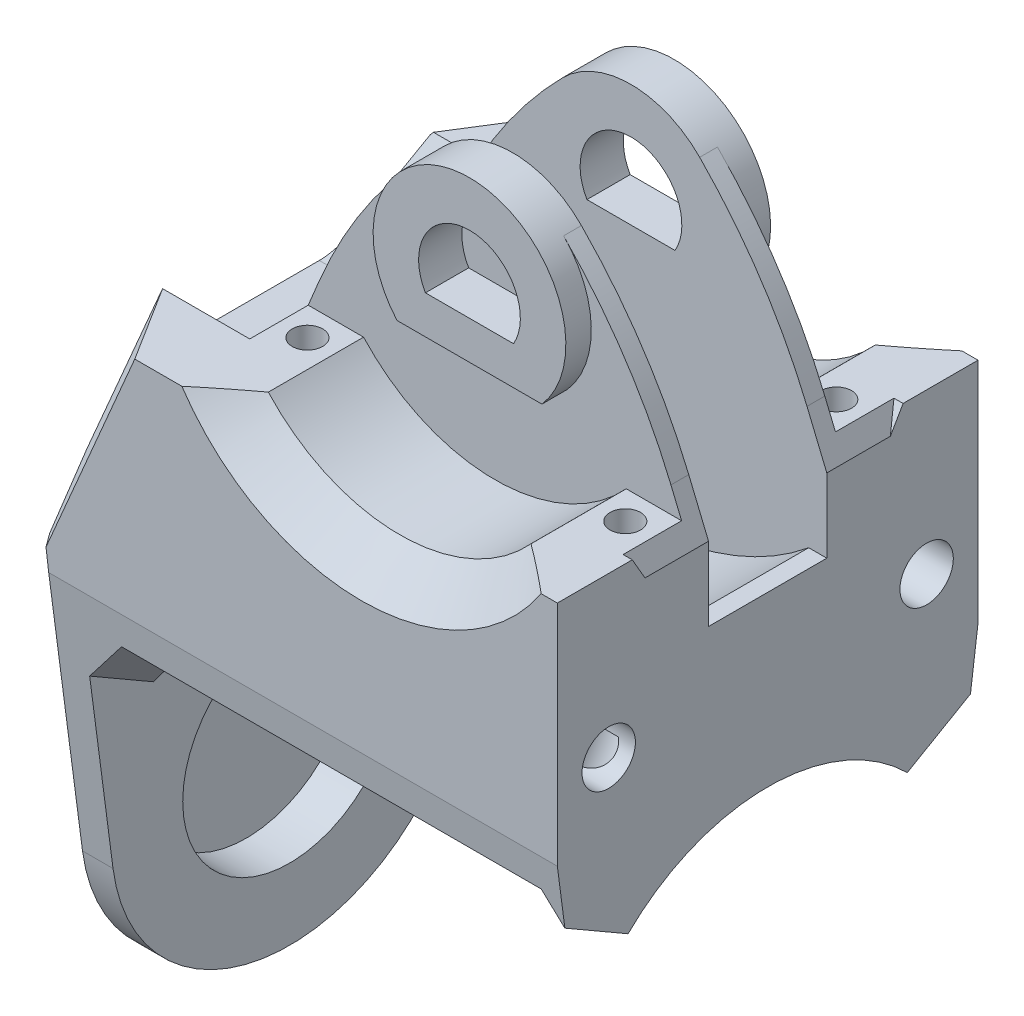
from build123d import *

# Parameters (mm, degrees)
BOSS_EXTRUDE1_DEPTH             = 21.5
SKETCH1_3_R                     = 4.2
SKETCH1_3_R_2                   = 1.0500000000000005
BOSS_EXTRUDE2_DEPTH             = 2.7
SKETCH1_4_R                     = 4.2
BOSS_EXTRUDE3_DEPTH             = 1
BOSS_EXTRUDE4_START             = 20.7
BOSS_EXTRUDE4_DEPTH             = 0.8
CHAMFER1_SIZE                   = 3
CHAMFER1_SIZE_2                 = 5.196152423
CHAMFER2_SIZE                   = 3
CHAMFER2_SIZE_2                 = 5.196152423
FILLET1_R                       = 1.15
CUT_EXTRUDE1_DEPTH              = 30.354742802484235
CUT_EXTRUDE1_DEPTH_BACK         = 30.354742802484235
BOSS_EXTRUDE5_REACH             = 31.355
BOSS_EXTRUDE5_DIRECTION_2_REACH = 31.355
BOSS_EXTRUDE6_DEPTH             = 3.0250000000000004
BOSS_EXTRUDE7_DEPTH             = 4.025
CUT_EXTRUDE2_START              = 21.5
SKETCH1_9_R                     = 1.0500000000000005
CUT_EXTRUDE2_DEPTH              = 2.5
CUT_EXTRUDE3_DEPTH              = 2.325
CHAMFER3_SIZE                   = 7
CHAMFER3_SIZE2                  = 3
CHAMFER4_SIZE                   = 3
CHAMFER4_SIZE2                  = 1.732050807568882
CHAMFER5_SIZE                   = 1.5
CHAMFER6_SIZE                   = 1.5
CHAMFER7_SIZE                   = 0.8
CUT_SWEEP1_OUTLINE_R            = 0.6
CUT_SWEEP1_ANGLE                = 45
CUT_SWEEP1_START                = 3
CUT_SWEEP1_2_OUTLINE_R          = 0.6
CUT_SWEEP1_2_DEPTH              = 7.606601818
CUT_SWEEP1_START_2              = 12.4249999
CUT_SWEEP1_3_OUTLINE_R          = 0.6
CUT_SWEEP1_3_DEPTH              = 2.5750001
CUT_SWEEP2_PROFILE_R            = 1.15
CUT_SWEEP3_PROFILE_R            = 0.6
CUT_SWEEP4_START                = 2
CUT_SWEEP4_OUTLINE_R            = 1.15
CUT_SWEEP4_OUTLINE_R_2          = 0.6
CUT_SWEEP4_DEPTH                = 5.593032776
MIRROR2_COPY_1_SKETCH_R         = 0.6
MIRROR2_START                   = 2
MIRROR2_COPY_2_SKETCH_R         = 1.15
MIRROR2_COPY_2_SKETCH_R_2       = 0.6
MIRROR2_COPY_2_DEPTH            = 5.593032776


with BuildPart() as part:
    # Sketch1 → Boss-Extrude1 (new body)
    with BuildSketch(Plane(origin=(0, 0, 0), x_dir=(0, 0, -1), z_dir=(1, 0, 0))):
        with BuildLine():
            Line((-2.325, 18.195), (-8.270000000000001, 18.195))
            Line((-8.270000000000001, 18.195), (-8.270000000000001, 9.234757272132784))
            Line((-8.270000000000001, 9.234757272132784), (-8.10502254384051, 7.975803084776965))
            Line((-8.10502254384051, 7.975803084776965), (-5.598146398328868, 6.528457467340776))
            ThreePointArc((-5.598146398328871, 6.528457467340778), (2.2e-16, 8.600000000000001), (5.59814639832887, 6.528457467340778))
            Line((5.598146398328868, 6.528457467340776), (8.10502254384051, 7.975803084776965))
            Line((8.10502254384051, 7.975803084776965), (8.270000000000001, 9.234757272132784))
            Line((8.270000000000001, 9.234757272132784), (8.270000000000001, 18.195))
            Line((8.270000000000001, 18.195), (2.325, 18.195))
            Line((2.325, 18.195), (2.3250000000000006, 14.425000000000002))
            Line((2.3250000000000006, 14.425000000000002), (-2.3250000000000006, 14.425000000000002))
            Line((-2.3250000000000006, 14.425000000000002), (-2.325, 18.195))
        make_face()
    extrude(amount=BOSS_EXTRUDE1_DEPTH)

    # Sketch1<3> → Boss-Extrude2 (add)
    with BuildSketch(Plane(origin=(0, 0, 0), x_dir=(0, 0, -1), z_dir=(1, 0, 0))):
        with BuildLine():
            Line((-8.270000000000001, 18.195), (-8.270000000000001, 9.234757272132784))
            Line((-8.270000000000001, 9.234757272132784), (-6.940659997902598, -0.9095266865324623))
            ThreePointArc((-6.940659997902598, -0.9095266865324623), (-2.68e-15, -7.000000000000001), (6.940659997902598, -0.9095266865324653))
            Line((6.940659997902598, -0.9095266865324653), (8.270000000000001, 9.234757272132784))
            Line((8.270000000000001, 9.234757272132784), (8.270000000000001, 18.195))
            Line((8.270000000000001, 18.195), (2.325, 18.195))
            Line((2.325, 18.195), (2.3250000000000006, 14.425000000000002))
            Line((2.3250000000000006, 14.425000000000002), (-2.3250000000000006, 14.425000000000002))
            Line((-2.3250000000000006, 14.425000000000002), (-2.325, 18.195))
            Line((-2.325, 18.195), (-8.270000000000001, 18.195))
        make_face()
        with Locations(Location((0, 0, 0), (0, 0, 180))):
            Circle(SKETCH1_3_R, mode=Mode.SUBTRACT)
        with Locations((-6.25, 11.925000000000002)):
            Circle(SKETCH1_3_R_2, mode=Mode.SUBTRACT)
        with Locations((6.25, 11.925000000000002)):
            Circle(SKETCH1_3_R_2, mode=Mode.SUBTRACT)
    extrude(amount=BOSS_EXTRUDE2_DEPTH)

    # Sketch1<4> → Boss-Extrude3 (add)
    with BuildSketch(Plane(origin=(0, 0, 0), x_dir=(0, 0, -1), z_dir=(1, 0, 0))):
        with Locations(Location((0, 0, 0), (0, 0, 180))):
            Circle(SKETCH1_4_R)
    extrude(amount=BOSS_EXTRUDE3_DEPTH)

    # Sketch1<12> → Boss-Extrude4 (add)
    with BuildSketch(Plane(origin=(0, 0, 0), x_dir=(0, 0, -1), z_dir=(1, 0, 0)).offset(BOSS_EXTRUDE4_START)):
        with BuildLine():
            Line((-5.598146398328868, 6.528457467340776), (-8.10502254384051, 7.975803084776965))
            Line((-8.10502254384051, 7.975803084776965), (-7.974061756180174, 6.976432408064584))
            Line((-7.974061756180173, 6.976432408064585), (-5.4890372325024295, 5.541702830376426))
            ThreePointArc((-5.4890372325024295, 5.541702830376424), (-6.7e-16, 7.799999999999999), (5.4890372325024295, 5.541702830376426))
            Line((5.4890372325024295, 5.541702830376426), (7.974061756180173, 6.976432408064585))
            Line((7.974061756180174, 6.976432408064585), (8.10502254384051, 7.975803084776965))
            Line((8.10502254384051, 7.975803084776965), (5.598146398328868, 6.528457467340776))
            ThreePointArc((5.59814639832887, 6.528457467340778), (2.2e-16, 8.600000000000001), (-5.598146398328871, 6.528457467340778))
        make_face()
    extrude(amount=BOSS_EXTRUDE4_DEPTH)

    # Chamfer1
    # the kernel refuses this chamfer: 5.196152423, 3 mm, written as the material it takes off along each edge
    with BuildSketch(Plane(origin=(34.942891911753655, 18.195, -2.325), x_dir=(0, 0, -1), z_dir=(-1, 0, 0))) as chamfer1_piece_1_section:
        Polygon((CHAMFER1_SIZE, 0), (4.4e-16, CHAMFER1_SIZE_2), (0, 0), align=None)
    chamfer1_piece_1 = extrude(amount=48.38578382350731, mode=Mode.PRIVATE)
    chamfer1_piece_1 = split(chamfer1_piece_1, bisect_by=Plane(origin=(34.942891911753655, 14.425000000000002, -2.325), z_dir=(0, 1, 0)), keep=Keep.TOP, mode=Mode.PRIVATE)
    add(chamfer1_piece_1, mode=Mode.SUBTRACT)

    # Chamfer2
    # the kernel refuses this chamfer: 5.196152423, 3 mm, written as the material it takes off along each edge
    with BuildSketch(Plane(origin=(34.942891911753655, 18.195, 2.325), x_dir=(0, 0, 1), z_dir=(-1, 0, 0))) as chamfer2_piece_1_section:
        Polygon((CHAMFER2_SIZE, 0), (4.4e-16, -CHAMFER2_SIZE_2), (0, 0), align=None)
    chamfer2_piece_1 = extrude(amount=48.38578382350731, mode=Mode.PRIVATE)
    chamfer2_piece_1 = split(chamfer2_piece_1, bisect_by=Plane(origin=(34.942891911753655, 14.425000000000002, 2.325), z_dir=(0, 1, 0)), keep=Keep.TOP, mode=Mode.PRIVATE)
    add(chamfer2_piece_1, mode=Mode.SUBTRACT)

    # Fillet1
    fillet1_edges = [part.edges().sort_by_distance(p)[0] for p in [
        (10.75, 14.425, 3.148389485277999),
        (10.75, 14.425, -3.148389485277999),
    ]]
    fillet(fillet1_edges, radius=FILLET1_R)

    # Sketch2<15> → Cut-Extrude1 (cut, two sides: drawn at the far end of the back side and taken through both)
    with BuildSketch(Plane.XY.offset(-CUT_EXTRUDE1_DEPTH_BACK)):
        with BuildLine():
            ThreePointArc((17.59, 22.92000000000001), (17.346830507091855, 21.58430042525929), (16.648525934584413, 20.42000000000001))
            ThreePointArc((16.648525934584413, 20.42000000000001), (15.363505676356857, 19.46752986978891), (13.800000000000084, 19.130000000000013))
            Line((13.800000000000004, 19.130000000000013), (13.800000000000004, 15.920000000000009))
            ThreePointArc((13.799999999999923, 15.920000000000009), (16.62179021190446, 16.5139481737969), (18.964724097180806, 18.195000000000014))
            Line((18.964724097180806, 18.195000000000014), (21.140380963920695, 18.19500000000001))
            Line((21.14038096392069, 18.195000000000007), (20.721596735188264, 19.206034564713786))
            ThreePointArc((20.721596735188264, 19.206034564713786), (18.918907165991364, 22.59535799102607), (16.5018640924116, 25.57782437834725))
            ThreePointArc((16.501864092411594, 25.57782437834724), (17.307432459095963, 24.355972682497843), (17.59, 22.92000000000001))
        make_face()
        with BuildLine():
            ThreePointArc((13.800000000000084, 19.130000000000013), (12.236494323643225, 19.467529869788873), (10.951474065415596, 20.420000000000012))
            ThreePointArc((10.951474065415596, 20.420000000000012), (10.011531253604911, 23.02772445213393), (11.098135907588413, 25.57782437834724))
            ThreePointArc((11.098135907588404, 25.57782437834725), (8.681092834008648, 22.595357991026066), (6.878403264811748, 19.206034564713786))
            Line((6.878403264811747, 19.206034564713786), (6.459619036079321, 18.195000000000007))
            Line((6.459619036079317, 18.19500000000001), (8.635275902819204, 18.195000000000014))
            ThreePointArc((8.635275902819203, 18.195000000000014), (10.978209788095471, 16.513948173796933), (13.799999999999923, 15.920000000000009))
            Line((13.800000000000004, 15.920000000000009), (13.800000000000004, 19.130000000000013))
        make_face()
    extrude(amount=CUT_EXTRUDE1_DEPTH + CUT_EXTRUDE1_DEPTH_BACK, mode=Mode.SUBTRACT)

    # Boss-Extrude5: up to this face of the body (flat: up to its plane)
    boss_extrude5_end = Plane(part.part.faces().sort_by_distance((10.468866668, 13.38709362, 8.27))[0])
    # Sketch2 → Boss-Extrude5 (add, up to the picked face)
    with BuildSketch(Plane.XY, mode=Mode.PRIVATE) as boss_extrude5_sk1:
        with BuildLine():
            ThreePointArc((18.964724097180806, 18.195000000000014), (13.800000000000004, 15.920000000000009), (8.635275902819203, 18.195000000000014))
            Line((8.635275902819204, 18.195000000000014), (6.459619036079317, 18.19500000000001))
            Line((6.459619036079321, 18.195000000000007), (4.898033905932744, 14.425))
            Line((4.898033905932742, 14.425), (21.5, 14.425000000000002))
            Line((21.5, 14.425000000000002), (21.5, 17.32680284580981))
            Line((21.499999999999996, 17.32680284580981), (21.14038096392069, 18.195000000000007))
            Line((21.140380963920695, 18.19500000000001), (18.964724097180806, 18.195000000000014))
        make_face()
    boss_extrude5_tool1 = split(extrude(boss_extrude5_sk1.sketch, amount=BOSS_EXTRUDE5_REACH, mode=Mode.PRIVATE), bisect_by=boss_extrude5_end, keep=Keep.BOTH, mode=Mode.PRIVATE)
    add(boss_extrude5_tool1.solids().sort_by(Axis((13.473223, 15.900042, 0), (0, 0, 1)))[0])

    # Boss-Extrude5 direction 2: up to this face of the body (flat: up to its plane)
    boss_extrude5_direction_2_end = Plane(part.part.faces().sort_by_distance((10.468866668, 13.38709362, -8.27))[0])
    # Sketch2 → Boss-Extrude5 direction 2 (add, up to the picked face)
    with BuildSketch(Plane.XY, mode=Mode.PRIVATE) as boss_extrude5_direction_2_sk1:
        with BuildLine():
            ThreePointArc((18.964724097180806, 18.195000000000014), (13.800000000000004, 15.920000000000009), (8.635275902819203, 18.195000000000014))
            Line((8.635275902819204, 18.195000000000014), (6.459619036079317, 18.19500000000001))
            Line((6.459619036079321, 18.195000000000007), (4.898033905932744, 14.425))
            Line((4.898033905932742, 14.425), (21.5, 14.425000000000002))
            Line((21.5, 14.425000000000002), (21.5, 17.32680284580981))
            Line((21.499999999999996, 17.32680284580981), (21.14038096392069, 18.195000000000007))
            Line((21.140380963920695, 18.19500000000001), (18.964724097180806, 18.195000000000014))
        make_face()
    boss_extrude5_direction_2_tool1 = split(extrude(boss_extrude5_direction_2_sk1.sketch, amount=-BOSS_EXTRUDE5_DIRECTION_2_REACH, mode=Mode.PRIVATE), bisect_by=boss_extrude5_direction_2_end, keep=Keep.BOTH, mode=Mode.PRIVATE)
    add(boss_extrude5_direction_2_tool1.solids().sort_by(Axis((13.473223, 15.900042, 0), (0, 0, -1)))[0])

    # Sketch4<4> → Boss-Extrude6 (add, symmetric)
    with BuildSketch(Plane.XY):
        with BuildLine():
            Line((16.648525934584413, 20.42000000000001), (10.951474065415594, 20.42000000000001))
            ThreePointArc((10.951474065415596, 20.420000000000012), (10.011531253604911, 23.02772445213393), (11.098135907588413, 25.57782437834724))
            ThreePointArc((11.098135907588404, 25.57782437834725), (8.681092834008648, 22.595357991026066), (6.878403264811748, 19.206034564713786))
            Line((6.878403264811747, 19.206034564713786), (6.459619036079321, 18.195000000000007))
            Line((6.459619036079317, 18.19500000000001), (8.635275902819204, 18.195000000000014))
            ThreePointArc((8.635275902819203, 18.195000000000014), (13.800000000000004, 15.920000000000009), (18.964724097180806, 18.195000000000014))
            Line((18.964724097180806, 18.195000000000014), (21.140380963920695, 18.19500000000001))
            Line((21.14038096392069, 18.195000000000007), (20.721596735188264, 19.206034564713786))
            ThreePointArc((20.721596735188264, 19.206034564713786), (18.918907165991364, 22.59535799102607), (16.5018640924116, 25.57782437834725))
            ThreePointArc((16.501864092411594, 25.57782437834724), (17.588468746395097, 23.02772445213393), (16.648525934584413, 20.42000000000001))
        make_face()
    extrude(amount=BOSS_EXTRUDE6_DEPTH, both=True)

    # Sketch4<5> → Boss-Extrude7 (add, symmetric)
    with BuildSketch(Plane.XY):
        with BuildLine():
            ThreePointArc((16.648525934584413, 20.42000000000001), (13.800000000000006, 26.710000000000004), (10.951474065415596, 20.420000000000012))
            Line((10.951474065415594, 20.42000000000001), (13.800000000000004, 20.42000000000001))
            Line((13.800000000000004, 20.42000000000001), (16.648525934584413, 20.42000000000001))
        make_face()
        with BuildLine():
            ThreePointArc((12.067949192431122, 21.92), (13.800000000000004, 24.920000000000016), (15.532050807568886, 21.92))
            Line((15.532050807568881, 21.920000000000005), (12.06794919243113, 21.920000000000005))
        make_face(mode=Mode.SUBTRACT)
    extrude(amount=BOSS_EXTRUDE7_DEPTH, both=True)

    # Sketch1<9> → Cut-Extrude2 (cut)
    with BuildSketch(Plane(origin=(0, 0, 0), x_dir=(0, 0, -1), z_dir=(1, 0, 0)).offset(CUT_EXTRUDE2_START)):
        with Locations((-6.25, 11.925000000000002)):
            Circle(SKETCH1_9_R)
        with Locations((6.25, 11.925000000000002)):
            Circle(SKETCH1_9_R)
    extrude(amount=-CUT_EXTRUDE2_DEPTH, mode=Mode.SUBTRACT)

    # Sketch2<8> → Cut-Extrude3 (cut, symmetric)
    with BuildSketch(Plane.XY):
        with BuildLine():
            Line((6.878403264811748, 19.206034564713786), (4.898033905932742, 14.425))
            Line((4.898033905932742, 14.425), (6.811797441401705, 14.425))
            ThreePointArc((6.811797441401703, 14.425), (13.800000000000004, 11.920000000000009), (20.788202558598304, 14.425))
            Line((20.788202558598304, 14.425000000000002), (21.5, 14.425000000000002))
            Line((21.5, 14.425000000000002), (21.5, 17.32680284580981))
            Line((21.5, 17.32680284580981), (20.721596735188264, 19.206034564713786))
            ThreePointArc((20.721596735188264, 19.206034564713786), (18.918907165991364, 22.59535799102607), (16.5018640924116, 25.57782437834725))
            ThreePointArc((16.501864092411587, 25.577824378347234), (13.800000000000004, 26.70999999999999), (11.098135907588421, 25.577824378347234))
            ThreePointArc((11.098135907588404, 25.57782437834725), (8.681092834008648, 22.595357991026066), (6.878403264811748, 19.206034564713786))
        make_face()
        with BuildLine():
            ThreePointArc((12.067949192431122, 21.92), (13.800000000000004, 24.920000000000016), (15.532050807568886, 21.92))
            Line((15.532050807568881, 21.920000000000005), (12.06794919243113, 21.920000000000005))
        make_face(mode=Mode.SUBTRACT)
    extrude(amount=CUT_EXTRUDE3_DEPTH, both=True, mode=Mode.SUBTRACT)

    # Chamfer3
    chamfer3_edges = [part.edges().sort_by_distance(p)[0] for p in [
        (0, 18.195, 6.7975),
    ]]
    chamfer3_side = [part.faces().sort_by_distance(p)[0] for p in [
        (0, 5.823364517218268, 1.9e-16),
    ]]
    chamfer(chamfer3_edges, length=CHAMFER3_SIZE, length2=CHAMFER3_SIZE2, reference=chamfer3_side[0])

    # Chamfer4
    chamfer4_edges = [part.edges().sort_by_distance(p)[0] for p in [
        (1.500000000000001, 14.695000000000002, -8.270000000000003),
        (1.4999999999999996, 14.695, 8.270000000000001),
    ]]
    chamfer4_side = [part.faces().sort_by_distance(p)[0] for p in [
        (1.2102903332335826, 14.019010777545025, -8.7e-16),
    ]]
    chamfer(chamfer4_edges, length=CHAMFER4_SIZE, length2=CHAMFER4_SIZE2, reference=chamfer4_side[0])

    # Chamfer5
    chamfer5_edges = [part.edges().sort_by_distance(p)[0] for p in [
        (13.799999999999992, 15.920000000000009, 8.270000000000001),
        (13.799999999999992, 15.920000000000009, -8.270000000000001),
        (0, 3.140553900827822, -7.4713957460770395),
        (0, 3.1405539008278227, 7.471395746077039),
        (0, -7.000000000000003, 1.44e-15),
    ]]
    chamfer(chamfer5_edges, length=CHAMFER5_SIZE)

    # Chamfer6
    chamfer6_edges = [part.edges().sort_by_distance(p)[0] for p in [
        (2.7, 7.252130276058871, -6.85158447108469),
        (2.7, 8.600000000000003, 1.11e-15),
        (2.7, 7.252130276058871, 6.851584471084689),
    ]]
    chamfer(chamfer6_edges, length=CHAMFER6_SIZE)

    # Chamfer7
    chamfer7_edges = [part.edges().sort_by_distance(p)[0] for p in [
        (20.7, 6.259067619220506, -6.7315494943413015),
        (20.7, 7.799999999999999, 4.4e-16),
        (20.7, 6.259067619220506, 6.7315494943413015),
    ]]
    chamfer(chamfer7_edges, length=CHAMFER7_SIZE - 0.0001)  # a hair under: the kernel refuses the full size

    # Cut-Sweep1: read off the stored shape, not the designer's step
    # Cut-Sweep1 outline → Cut-Sweep1 (revolve, cut)
    with BuildSketch(Plane(origin=(2.575, 12.425, 0), x_dir=(0.7071067811865436, -0.7071067811865515, 0), z_dir=(-0.7071067811865515, -0.7071067811865436, 0))):
        with Locations((2.5, 0)):
            Circle(CUT_SWEEP1_OUTLINE_R)
    revolve(axis=Axis((2.575, 12.425, 0), (0, 0, 1)), revolution_arc=CUT_SWEEP1_ANGLE, mode=Mode.SUBTRACT)

    # Cut-Sweep1 2 outline → Cut-Sweep1 2 (cut)
    with BuildSketch(Plane(origin=(0, 0, 0), x_dir=(0.7071067811865513, -0.7071067811865437, 0), z_dir=(0.7071067811865436, 0.7071067811865516, 0)).offset(CUT_SWEEP1_START)):
        with Locations((-4.465001795, 0)):
            Circle(CUT_SWEEP1_2_OUTLINE_R)
    extrude(amount=CUT_SWEEP1_2_DEPTH, mode=Mode.SUBTRACT)

    # Cut-Sweep1 3 outline → Cut-Sweep1 3 (cut)
    with BuildSketch(Plane(origin=(0, 0, 0), x_dir=(1, 0, 0), z_dir=(0, 1, 0)).offset(CUT_SWEEP1_START_2)):
        with Locations((5.075, 0)):
            Circle(CUT_SWEEP1_3_OUTLINE_R)
    extrude(amount=CUT_SWEEP1_3_DEPTH, mode=Mode.SUBTRACT)

    # Cut-Sweep2: sweep along a path in Sketch2<11>
    with BuildLine(Plane.XY) as cut_sweep2_path:
        Line((-2.7283008588990514, 3.5861652351681284), (4.342766952966383, 10.657233047033642))
    # Cut-Sweep2 profile (on start of the path) → Cut-Sweep2 (sweep, cut)
    with BuildSketch(Plane(origin=(-2.7283008588990514, 3.5861652351681284, 0), x_dir=(0.7071067811865516, -0.7071067811865436, 0), z_dir=(0.7071067811865436, 0.7071067811865516, 0))):
        Circle(CUT_SWEEP2_PROFILE_R)
    sweep(path=cut_sweep2_path.line, mode=Mode.SUBTRACT)

    # Cut-Sweep3: sweep along a path in Sketch3
    with BuildLine(Plane(origin=(7.550000000000004, 0, 0), x_dir=(0, 0, -1), z_dir=(1, 0, 0))) as cut_sweep3_path:
        Line((-4.147499999999999, 18.195000000000014), (-4.1475, 12.605614949013411))
        ThreePointArc((-4.1475, 12.605614949013411), (-4.23268543427733, 11.958567336257113), (-4.482436490538899, 11.355614949013418))
        Line((-4.482436490538899, 11.355614949013418), (-6.8515844710846885, 7.25213027605887))
    # Cut-Sweep3 profile (on start of the path) → Cut-Sweep3 (sweep, cut)
    with BuildSketch(Plane(origin=(7.550000000000004, 18.195000000000014, 4.147499999999999), x_dir=(0, -1.6e-16, -1), z_dir=(0, -1, 1.6e-16))):
        Circle(CUT_SWEEP3_PROFILE_R)
    cut_sweep3 = sweep(path=cut_sweep3_path.line, mode=Mode.SUBTRACT)

    # Cut-Sweep4: read off the stored shape, not the designer's step
    # Cut-Sweep4 outline → Cut-Sweep4 (cut)
    with BuildSketch(Plane(origin=(0, 0, 0), x_dir=(1, 0, 0), z_dir=(0, 0.8660254037844404, -0.49999999999999717)).offset(CUT_SWEEP4_START)):
        with Locations((7.55, -9.559711346)):
            Circle(CUT_SWEEP4_OUTLINE_R)
        with Locations((7.55, -9.559711346)):
            Circle(CUT_SWEEP4_OUTLINE_R_2, mode=Mode.SUBTRACT)
    cut_sweep4 = extrude(amount=CUT_SWEEP4_DEPTH, mode=Mode.SUBTRACT)

    # Mirror1: Cut-Sweep3, Cut-Sweep4 across plane
    add(cut_sweep3.mirror(Plane.XY), mode=Mode.SUBTRACT)
    add(cut_sweep4.mirror(Plane.XY), mode=Mode.SUBTRACT)

    # Mirror2: Cut-Sweep3, Cut-Sweep4 across plane
    add(cut_sweep3.mirror(Plane(origin=(13.800000000000004, 0, 0), x_dir=(0, 0, 1), z_dir=(1, 0, 0))), mode=Mode.SUBTRACT)
    add(cut_sweep4.mirror(Plane(origin=(13.800000000000004, 0, 0), x_dir=(0, 0, 1), z_dir=(1, 0, 0))), mode=Mode.SUBTRACT)

    # Mirror2 copy 1: sweep along a path in Mirror2 copy 1 path
    with BuildLine(Plane.ZY.offset(-20.050000000000004)) as mirror2_copy_1_path:
        Line((-4.147499999999999, 18.195000000000014), (-4.1475, 12.605614949013411))
        ThreePointArc((-4.1475, 12.605614949013411), (-4.23268543427733, 11.958567336257113), (-4.482436490538899, 11.355614949013418))
        Line((-4.482436490538899, 11.355614949013418), (-6.8515844710846885, 7.25213027605887))
    # Mirror2 copy 1 sketch → Mirror2 copy 1 (sweep, cut)
    with BuildSketch(Plane(origin=(20.050000000000004, 18.195000000000014, -4.147499999999999), x_dir=(0, -1.6e-16, 1), z_dir=(0, -1, -1.6e-16))):
        Circle(MIRROR2_COPY_1_SKETCH_R)
    sweep(path=mirror2_copy_1_path.line, mode=Mode.SUBTRACT)

    # Mirror2 copy 2 sketch → Mirror2 copy 2 (cut)
    with BuildSketch(Plane(origin=(27.60000000000001, 0, 0), x_dir=(-1, 0, 0), z_dir=(0, 0.8660254037844404, 0.49999999999999717)).offset(MIRROR2_START)):
        with Locations((7.55, -9.559711346)):
            Circle(MIRROR2_COPY_2_SKETCH_R)
        with Locations((7.55, -9.559711346)):
            Circle(MIRROR2_COPY_2_SKETCH_R_2, mode=Mode.SUBTRACT)
    extrude(amount=MIRROR2_COPY_2_DEPTH, mode=Mode.SUBTRACT)


solid = part.part
